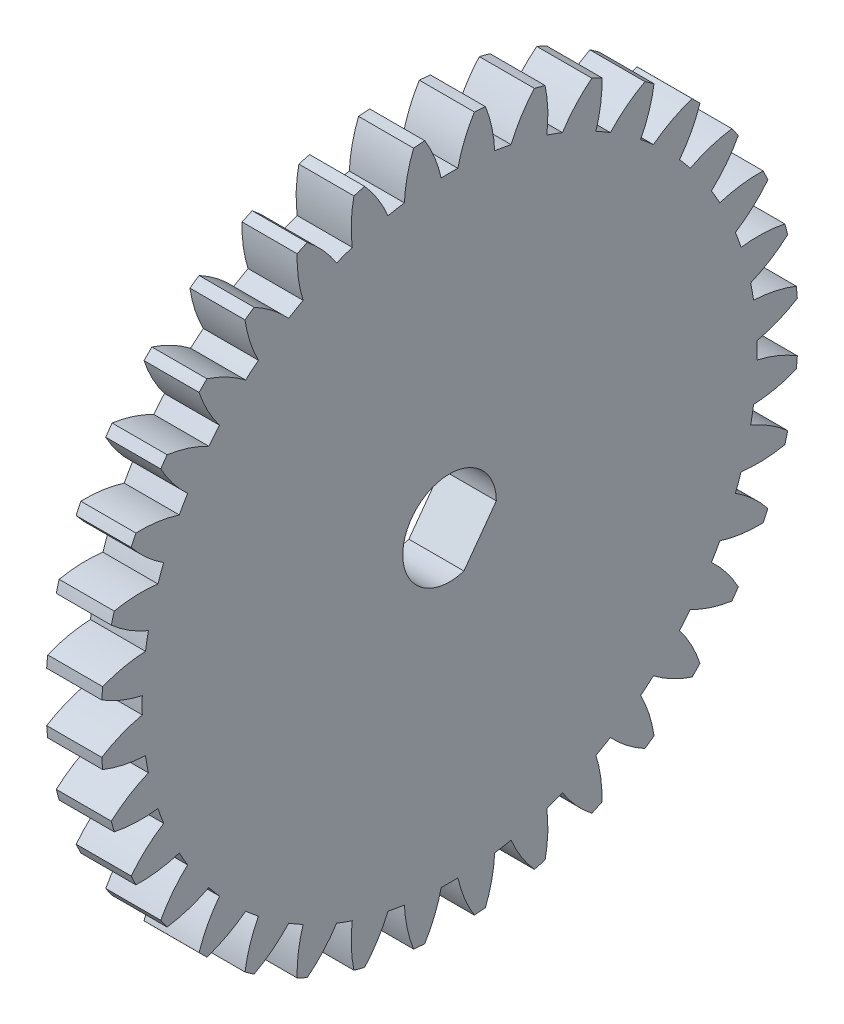
from build123d import *

# Parameters (mm, degrees)
BASPROSKE_W        = 3
BASPROSKE_H        = 19
TOOTHCUT_DEPTH     = 28.037011669
TEETHCUTS_COUNT    = 36
TEETHCUTS_ANGLE    = 350
BORSKE_R           = 0.4
BORE_DEPTH         = 50.0000508
CUT_EXTRUDE2_DEPTH = 27.969139367


with BuildPart() as part:
    # BasProSke → Base-Revolve (revolve)
    with BuildSketch(Plane(origin=(0, 0, 0), x_dir=(1, 0, 0), z_dir=(0, 1, 0))):
        with Locations((1.5, 9.5)):
            Rectangle(BASPROSKE_W, BASPROSKE_H)
    revolve(axis=Axis((-10, 0, 0), (1, 0, 0)))

    # TooCutSke → ToothCut (cut, through all)
    with BuildSketch(Plane(origin=(0, 0, 0), x_dir=(0, 0, -1), z_dir=(1, 0, 0))):
        with BuildLine():
            ThreePointArc((0.454664826, 16.742827745), (0, 16.749), (-0.454664826, 16.742827745))
            ThreePointArc((-0.454664826, 16.742827745), (-0.817558311, 17.898033097), (-1.368909141, 18.976088452))
            ThreePointArc((-1.368909141, 18.976088452), (0, 19.0254), (1.368909141, 18.976088452))
            ThreePointArc((1.368909141, 18.976088452), (0.817558311, 17.898033097), (0.454664826, 16.742827745))
        make_face()
    toothcut = extrude(amount=TOOTHCUT_DEPTH, mode=Mode.SUBTRACT)

    # TeethCuts: ToothCut ×36 about axis
    teethcuts_axis = Axis((-10, 0, 0), (1, 0, 0))
    for i in range(1, TEETHCUTS_COUNT):
        add(toothcut.rotate(teethcuts_axis, i * TEETHCUTS_ANGLE / (TEETHCUTS_COUNT - 1)), mode=Mode.SUBTRACT)

    # BorSke → Bore (cut, symmetric)
    with BuildSketch(Plane(origin=(0, 0, 0), x_dir=(0, 0, -1), z_dir=(1, 0, 0))):
        Circle(BORSKE_R)
    extrude(amount=BORE_DEPTH, both=True, mode=Mode.SUBTRACT)

    # Sketch2 → Cut-Extrude2 (cut, through all)
    with BuildSketch(Plane.ZY):
        with BuildLine():
            Line((-2.55, 0), (-0.785294118, -2.426069486))
            ThreePointArc((-0.785294118, -2.426069486), (2.062159063, 1.5), (-2.55, 0))
        make_face()
    extrude(amount=-CUT_EXTRUDE2_DEPTH, mode=Mode.SUBTRACT)


solid = part.part
